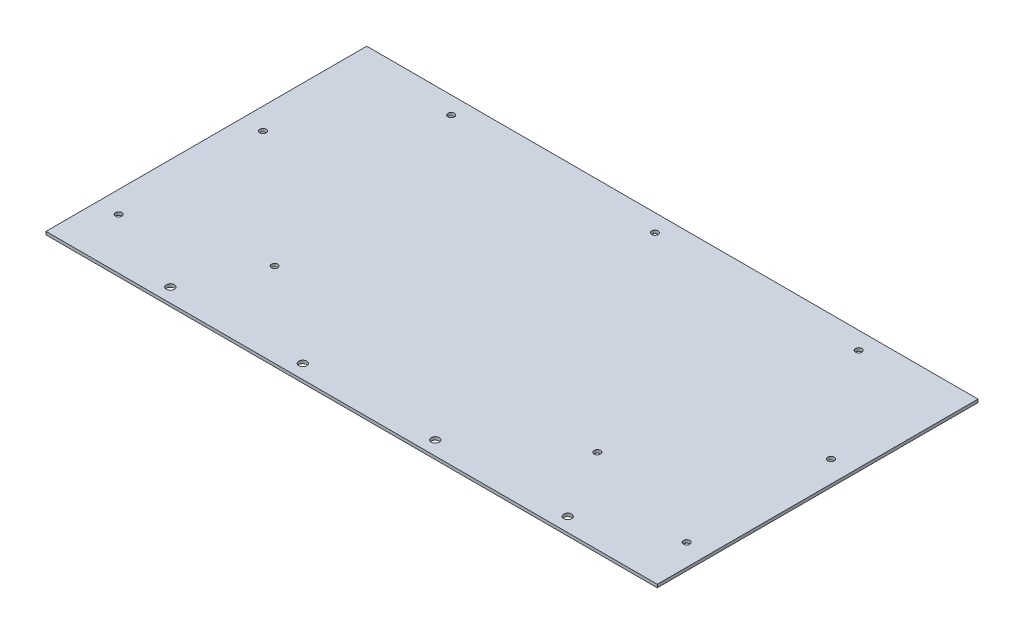
from build123d import *

# Parameters (mm, degrees)
SKETCH1_W            = 457.223
SKETCH1_H            = 2.286
BOSS_EXTRUDE1_DEPTH  = 238.315200026
SKETCH9_R            = 3
CUT_EXTRUDE10_DEPTH  = 2.54
LPATTERN1_COUNT      = 4
LPATTERN1_PITCH      = 99.06
SKETCH15_W           = 457.223
SKETCH15_H           = 2.286
BOSS_EXTRUDE3_DEPTH  = 1.5875
M4_CLEARANCE_HOLE1_D = 4.8


with BuildPart() as part:
    # Sketch1 → Boss-Extrude1 (new body)
    with BuildSketch(Plane.XY):
        Rectangle(SKETCH1_W, SKETCH1_H)
    extrude(amount=BOSS_EXTRUDE1_DEPTH)

    # Sketch9 → Cut-Extrude10 (cut)
    with BuildSketch(Plane(origin=(0, 1.143, 0), x_dir=(1, 0, 0), z_dir=(0, 1, 0))):
        with Locations((-146.0615, -229.425200026)):
            Circle(SKETCH9_R)
    cut_extrude10 = extrude(amount=-CUT_EXTRUDE10_DEPTH, mode=Mode.SUBTRACT)

    # LPattern1: Cut-Extrude10 ×4
    with Locations(*[(i * LPATTERN1_PITCH, 0, 0) for i in range(1, LPATTERN1_COUNT)]):
        add(cut_extrude10, mode=Mode.SUBTRACT)

    # Sketch15 → Boss-Extrude3 (add)
    with BuildSketch(Plane.XY.offset(238.315200026)):
        Rectangle(SKETCH15_W, SKETCH15_H)
    extrude(amount=BOSS_EXTRUDE3_DEPTH)

    # M4 Clearance Hole1 (through all)
    with Locations(Plane.XZ.offset(1.143)):
        with Locations((-212.419, 201.724823778), (-212.419, 93.774823778), (-152.4, 13.0175), (0, 13.0175), (152.4, 13.0175), (212.419, 93.774823778), (212.419, 201.724823778), (120.65, 176.776), (-120.65, 176.776)):
            Hole(M4_CLEARANCE_HOLE1_D / 2)


solid = part.part
